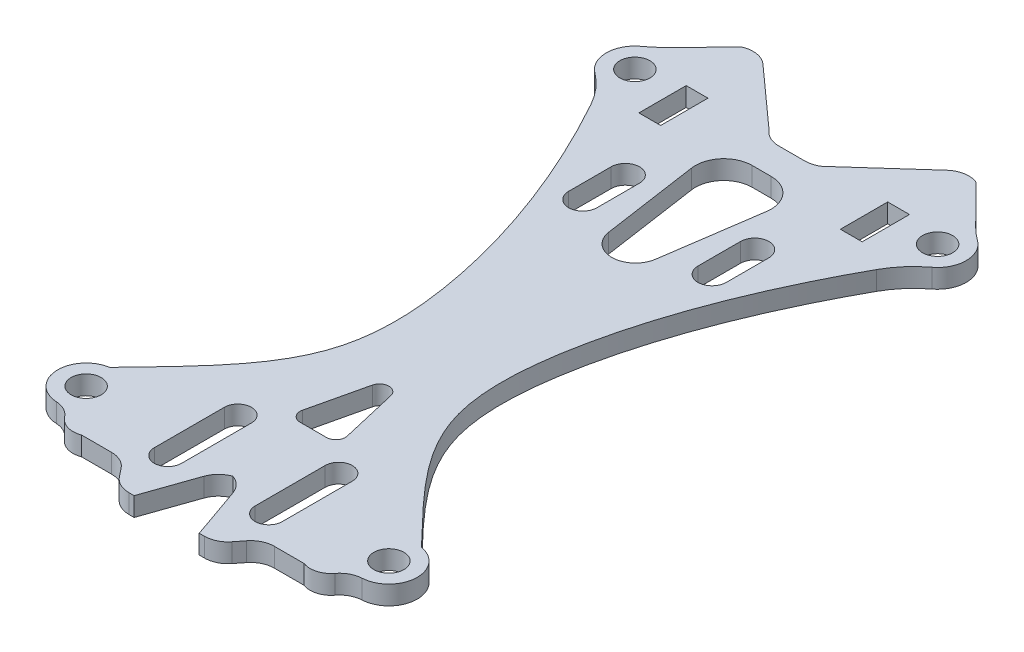
from build123d import *

# Parameters (mm, degrees)
CROQUIS1_R              = 1.5875
CROQUIS1_W              = 2.3
CROQUIS1_H              = 5
SALIENTE_EXTRUIR2_DEPTH = 2


with BuildPart() as part:
    # Croquis1 → Saliente-Extruir2 (new body)
    with BuildSketch(Plane(origin=(0, 0, 0), x_dir=(1, 0, 0), z_dir=(0, 1, 0))):
        with BuildLine():
            Line((-16.480667553, 34.308861695), (-12.360433034, 38.465198907))
            ThreePointArc((-12.360433034, 38.465198907), (-10.976177414, 38.625905094), (-9.720947248, 38.02060572))
            Line((-9.720947248, 38.02060572), (-3.322488701, 32.274022361))
            ThreePointArc((-3.322488701, 32.274022361), (-2.458365437, 31.59854227), (-1.38827399, 31.357945796))
            Line((-1.38827399, 31.357945796), (-0.040723182, 31.357945796))
            Line((-0.040723182, 31.357945796), (0.040723182, 31.357945796))
            Line((0.040723182, 31.357945796), (1.38827399, 31.357945796))
            ThreePointArc((1.38827399, 31.357945796), (2.458365437, 31.59854227), (3.322488701, 32.274022361))
            Line((3.322488701, 32.274022361), (9.720947248, 38.02060572))
            ThreePointArc((9.720947248, 38.02060572), (10.976177414, 38.625905094), (12.360433034, 38.465198907))
            Line((12.360433034, 38.465198907), (16.480667553, 34.308861695))
            ThreePointArc((16.480667553, 34.308861695), (17.096819729, 33.7374616), (17.758770075, 33.21980987))
            ThreePointArc((17.758770075, 33.21980987), (19.01975151, 30.803529349), (17.821171848, 28.355695095))
            ThreePointArc((17.821171848, 28.355695095), (16.296015675, 26.929442436), (15.100302974, 25.217551921))
            add(Edge.make_bspline(
                [(16.480003997, -24.273860676), (11.403720972, -18.985801718), (4.646306516, -12.289989339), (6.333711458, 7.023630957), (11.636055478, 18.952511781), (15.100302974, 25.217551921)],
                knots=[0, 0, 0, 0, 0.308743397, 0.525126437, 0.93919625, 0.93919625, 0.93919625, 0.93919625], degree=3))
            ThreePointArc((16.480003997, -24.273860676), (18.995591027, -27.397797663), (16.156672128, -30.231117252))
            ThreePointArc((16.156672128, -30.231117252), (15.118463568, -30.51773293), (14.297183252, -31.2145286))
            ThreePointArc((14.297183252, -31.2145286), (13.14914912, -32.001644324), (11.758219481, -31.948275137))
            Line((11.758219481, -31.948275137), (8.598739942, -31.948275137))
            ThreePointArc((8.598739942, -31.948275137), (7.506720993, -32.19938772), (6.634077803, -32.902279446))
            Line((6.634077803, -32.902279446), (5.953226574, -33.767509951))
            ThreePointArc((5.953226574, -33.767509951), (5.080583384, -34.470401676), (3.988564435, -34.721514259))
            Line((3.988564435, -34.721514259), (3.441216411, -34.721514259))
            Line((3.441216411, -34.721514259), (1.533856825, -29.262119003))
            ThreePointArc((1.533856825, -29.262119003), (0.942151005, -28.319542636), (0, -27.727159764))
            ThreePointArc((0, -27.727159764), (-0.942151005, -28.319542636), (-1.533856825, -29.262119003))
            Line((-1.533856825, -29.262119003), (-3.441216411, -34.721514259))
            Line((-3.441216411, -34.721514259), (-3.988564435, -34.721514259))
            ThreePointArc((-3.988564435, -34.721514259), (-5.080583384, -34.470401676), (-5.953226574, -33.767509951))
            Line((-5.953226574, -33.767509951), (-6.634077803, -32.902279446))
            ThreePointArc((-6.634077803, -32.902279446), (-7.506720993, -32.19938772), (-8.598739942, -31.948275137))
            Line((-8.598739942, -31.948275137), (-11.758219481, -31.948275137))
            ThreePointArc((-11.758219481, -31.948275137), (-13.14914912, -32.001644324), (-14.297183252, -31.2145286))
            ThreePointArc((-14.297183252, -31.2145286), (-15.118463568, -30.51773293), (-16.156672128, -30.231117252))
            ThreePointArc((-16.156672128, -30.231117252), (-18.995591027, -27.397797663), (-16.480003997, -24.273860676))
            add(Edge.make_bspline(
                [(-16.480003997, -24.273860676), (-11.403720972, -18.985801718), (-4.646306516, -12.289989339), (-6.333711458, 7.023630957), (-11.636055478, 18.952511781), (-15.100302974, 25.217551921)],
                knots=[0, 0, 0, 0, 0.308743397, 0.525126437, 0.93919625, 0.93919625, 0.93919625, 0.93919625], degree=3))
            ThreePointArc((-15.100302974, 25.217551921), (-16.296015675, 26.929442436), (-17.821171848, 28.355695095))
            ThreePointArc((-17.821171848, 28.355695095), (-19.01975151, 30.803529349), (-17.758770075, 33.21980987))
            ThreePointArc((-17.758770075, 33.21980987), (-17.096819729, 33.7374616), (-16.480667553, 34.308861695))
        make_face()
        with Locations((16, -27.235211071)):
            Circle(CROQUIS1_R, mode=Mode.SUBTRACT)
        with Locations((-16, 30.764788929)):
            Circle(CROQUIS1_R, mode=Mode.SUBTRACT)
        with Locations((16, 30.764788929)):
            Circle(CROQUIS1_R, mode=Mode.SUBTRACT)
        with Locations((-16, -27.235211071)):
            Circle(CROQUIS1_R, mode=Mode.SUBTRACT)
        with BuildLine():
            Line((-3.893843837, -21.867659367), (-3.893843837, -29.262119003))
            ThreePointArc((-3.893843837, -29.262119003), (-5.328876623, -30.697151789), (-6.76390941, -29.262119003))
            Line((-6.76390941, -29.262119003), (-6.76390941, -21.867659367))
            ThreePointArc((-6.76390941, -21.867659367), (-5.328876623, -20.432626581), (-3.893843837, -21.867659367))
        make_face(mode=Mode.SUBTRACT)
        with BuildLine():
            Line((-1.39382162, -19.231382002), (1.39382162, -19.231382002))
            ThreePointArc((1.39382162, -19.231382002), (2.176853635, -18.853363403), (2.367884319, -18.005103727))
            Line((2.367884319, -18.005103727), (0.974062699, -12.005103727))
            ThreePointArc((0.974062699, -12.005103727), (0, -11.231382002), (-0.974062699, -12.005103727))
            Line((-0.974062699, -12.005103727), (-2.367884319, -18.005103727))
            ThreePointArc((-2.367884319, -18.005103727), (-2.176853635, -18.853363403), (-1.39382162, -19.231382002))
        make_face(mode=Mode.SUBTRACT)
        with BuildLine():
            Line((-5.337166165, 20.592791948), (-5.337166165, 16.095612647))
            ThreePointArc((-5.337166165, 16.095612647), (-6.83649533, 14.596283481), (-8.335824496, 16.095612647))
            Line((-8.335824496, 16.095612647), (-8.335824496, 20.592791948))
            ThreePointArc((-8.335824496, 20.592791948), (-6.83649533, 22.092121114), (-5.337166165, 20.592791948))
        make_face(mode=Mode.SUBTRACT)
        with BuildLine():
            Line((3.893843837, -21.867659367), (3.893843837, -29.262119003))
            ThreePointArc((3.893843837, -29.262119003), (5.328876623, -30.697151789), (6.76390941, -29.262119003))
            Line((6.76390941, -29.262119003), (6.76390941, -21.867659367))
            ThreePointArc((6.76390941, -21.867659367), (5.328876623, -20.432626581), (3.893843837, -21.867659367))
        make_face(mode=Mode.SUBTRACT)
        with BuildLine():
            Line((5.337166165, 20.592791948), (5.337166165, 16.095612647))
            ThreePointArc((5.337166165, 16.095612647), (6.83649533, 14.596283481), (8.335824496, 16.095612647))
            Line((8.335824496, 16.095612647), (8.335824496, 20.592791948))
            ThreePointArc((8.335824496, 20.592791948), (6.83649533, 22.092121114), (5.337166165, 20.592791948))
        make_face(mode=Mode.SUBTRACT)
        with BuildLine():
            Line((-1.001806653, 28.16717115), (1.001806653, 28.16717115))
            ThreePointArc((1.001806653, 28.16717115), (3.270984433, 27.12952489), (3.970426322, 24.734392618))
            Line((3.970426322, 24.734392618), (2.473849725, 14.468710767))
            ThreePointArc((2.473849725, 14.468710767), (0, 12.329359543), (-2.473849725, 14.468710767))
            Line((-2.473849725, 14.468710767), (-3.970426322, 24.734392618))
            ThreePointArc((-3.970426322, 24.734392618), (-3.270984433, 27.12952489), (-1.001806653, 28.16717115))
        make_face(mode=Mode.SUBTRACT)
        with Locations((-10.65, 29.489574312)):
            Rectangle(CROQUIS1_W, CROQUIS1_H, mode=Mode.SUBTRACT)
        with Locations((10.65, 29.489574312)):
            Rectangle(CROQUIS1_W, CROQUIS1_H, mode=Mode.SUBTRACT)
    extrude(amount=SALIENTE_EXTRUIR2_DEPTH)


solid = part.part
